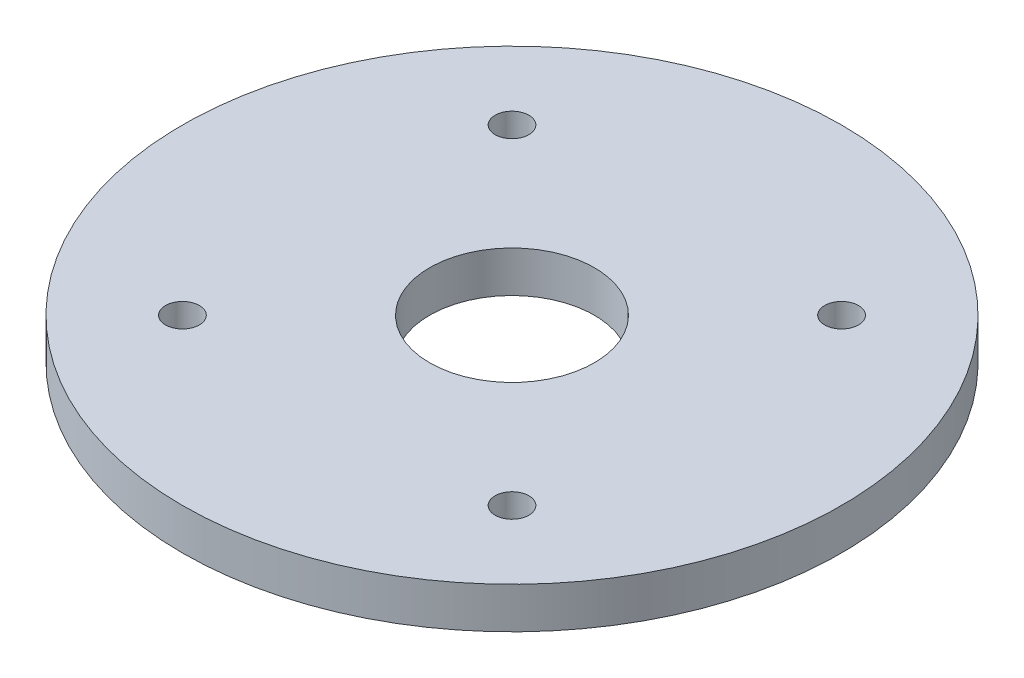
from build123d import *

# Parameters (mm, degrees)
SKETCH_1_R          = 20
SKETCH_1_R_2        = 5
EXTRUDE_1_DEPTH     = 2.5
HOLE_WIZARD_M2_51_D = 2.05


with BuildPart() as part:
    # Эскиз1 → Бобышка-Вытянуть1 (new body)
    with BuildSketch(Plane(origin=(0, 0, 0), x_dir=(1, 0, 0), z_dir=(0, 1, 0))):
        Circle(SKETCH_1_R)
        Circle(SKETCH_1_R_2, mode=Mode.SUBTRACT)
    extrude(amount=EXTRUDE_1_DEPTH)

    # Отверстие обработанное метчиком M2.51 (through all)
    with Locations(Plane(origin=(0, 2.5, 0), x_dir=(1, 0, 0), z_dir=(0, 1, 0))):
        with Locations((-10, 10), (10, 10), (10, -10), (-10, -10)):
            Hole(HOLE_WIZARD_M2_51_D / 2)


solid = part.part
